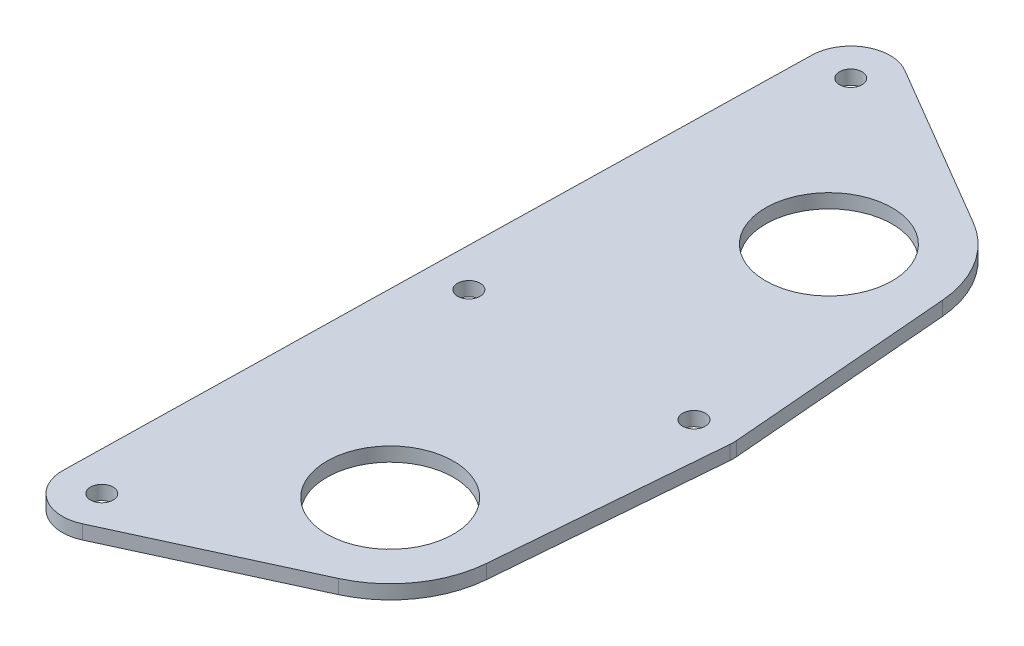
from build123d import *

# Parameters (mm, degrees)
SKETCH1_W                  = 88.9
SKETCH1_H                  = 190.5
SKETCH1_R                  = 14.2875
BOSS_EXTRUDE1_DEPTH        = 3.175
F_10_CLEARANCE_HOLE1_D     = 5.1054
F_10_CLEARANCE_HOLE1_DEPTH = 3.175
F_10_CLEARANCE_HOLE1_TIP   = 1.533816902
SKETCH4_OUTSIDE_W          = 132.95
SKETCH4_OUTSIDE_H          = 234.55
CUT_EXTRUDE1_DEPTH         = 108.996681083


with BuildPart() as part:
    # Sketch1 → Boss-Extrude1 (new body)
    with BuildSketch(Plane(origin=(0, 0, 0), x_dir=(1, 0, 0), z_dir=(0, 1, 0))):
        with Locations((-6.35, 0)):
            Rectangle(SKETCH1_W, SKETCH1_H)
        with Locations((0, 49.5046)):
            Circle(SKETCH1_R, mode=Mode.SUBTRACT)
        with Locations((0, -49.5046)):
            Circle(SKETCH1_R, mode=Mode.SUBTRACT)
    extrude(amount=BOSS_EXTRUDE1_DEPTH)

    # #10 Clearance Hole1
    with Locations(Plane(origin=(0, 3.175, 0), x_dir=(1, 0, 0), z_dir=(0, 1, 0))):
        with Locations((19.05, 0), (-29.994929259, 84.4296), (-33.3375, -81.2546), (-31.75, 0)):
            Hole(F_10_CLEARANCE_HOLE1_D / 2, depth=F_10_CLEARANCE_HOLE1_DEPTH)
            with Locations((0, 0, -(F_10_CLEARANCE_HOLE1_DEPTH + F_10_CLEARANCE_HOLE1_TIP / 2))):  # 118° drill point
                Cone(0, F_10_CLEARANCE_HOLE1_D / 2, F_10_CLEARANCE_HOLE1_TIP, mode=Mode.SUBTRACT)

    # Sketch4 outside → Cut-Extrude1 (cut, through all)
    with BuildSketch(Plane(origin=(0, 3.175, 0), x_dir=(1, 0, 0), z_dir=(0, 1, 0))):
        with Locations((-6.35, 0)):
            Rectangle(SKETCH4_OUTSIDE_W, SKETCH4_OUTSIDE_H)
        with BuildLine():
            Line((12.066451595, 70.033504066), (-25.483685223, 92.104672933))
            ThreePointArc((-25.483685223, 92.104672933), (-34.335690579, 92.202363888), (-38.895706385, 84.614623896))
            Line((-38.895706385, 84.614623896), (-40.650892722, 0.179463032))
            Line((-40.650892722, 0.179463032), (-42.238501369, -81.080697973))
            ThreePointArc((-42.238501369, -81.080697973), (-38.213142347, -88.70350455), (-29.616483701, -89.342375034))
            Line((-29.616483701, -89.342375034), (9.952789672, -71.137379156))
            ThreePointArc((9.952789672, -71.137379156), (19.504135737, -63.165633834), (23.731666658, -51.464996354))
            Line((23.731666658, -51.464996354), (27.922479108, -0.73292685))
            ThreePointArc((27.922479108, -0.73292685), (27.9527, 0), (27.922479108, 0.73292685))
            Line((27.922479108, 0.73292685), (23.731666658, 51.464996354))
            ThreePointArc((23.731666658, 51.464996354), (20.163672465, 62.171938669), (12.066451595, 70.033504066))
        make_face(mode=Mode.SUBTRACT)
    extrude(amount=-CUT_EXTRUDE1_DEPTH, mode=Mode.SUBTRACT)


solid = part.part
